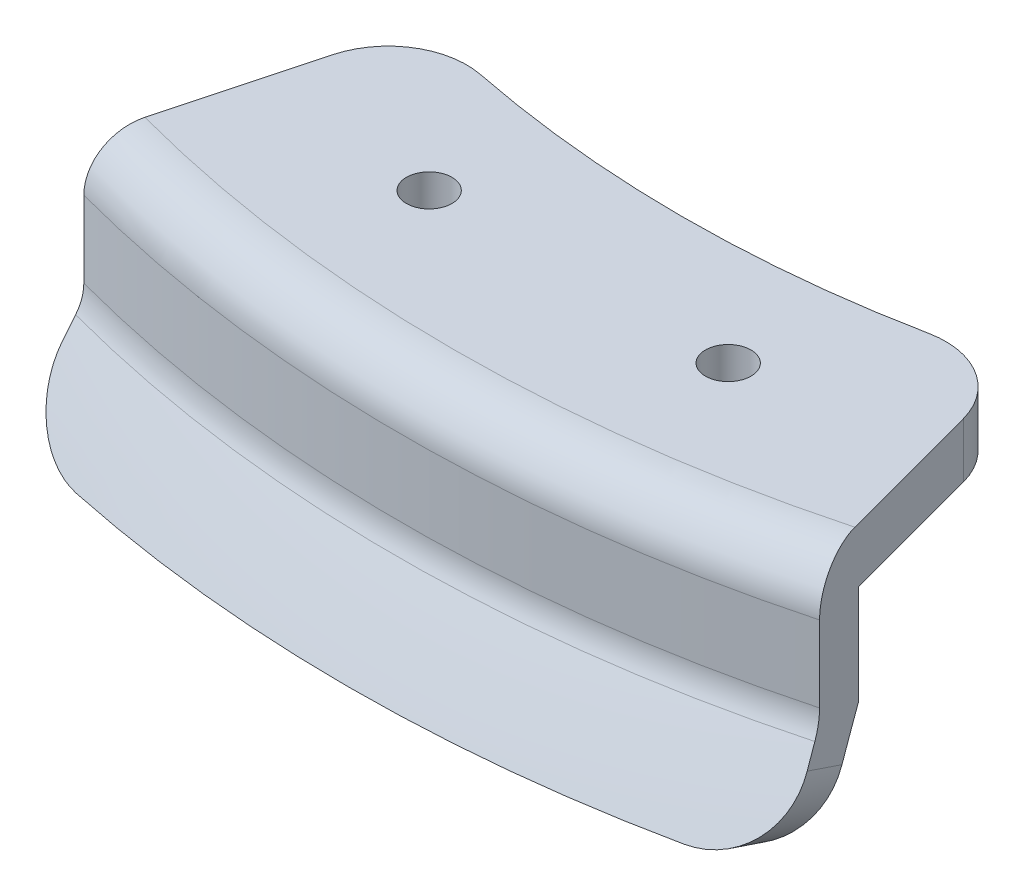
from build123d import *

# Parameters (mm, degrees)
REVOLVE1_ANGLE     = 30
FILLET1_R          = 6.35
SKETCH3_R          = 2.9
CUT_EXTRUDE1_DEPTH = 198.178612884
FILLET2_R          = 10


with BuildPart() as part:
    # Sketch2 → Revolve1 (revolve, symmetric)
    with BuildSketch(Plane(origin=(0, 0, 0), x_dir=(0, 0, -1), z_dir=(1, 0, 0))) as revolve1_sk:
        with BuildLine():
            Line((-174.101233777, 207.368503093), (-174.101233777, 194.668503093))
            ThreePointArc((-174.101233777, 194.668503093), (-178.094473937, 187.727434119), (-181.811130521, 180.634418589))
            Line((-181.811130521, 180.634418589), (-188.07430923, 183.760533184))
            ThreePointArc((-188.07430923, 183.760533184), (-184.699282146, 190.238239534), (-181.101233777, 196.594774384))
            Line((-181.101233777, 196.594774384), (-181.101233777, 214.368503093))
            Line((-181.101233777, 214.368503093), (-145.526233777, 214.368503093))
            Line((-145.526233777, 214.368503093), (-145.526233777, 207.368503093))
            Line((-145.526233777, 207.368503093), (-174.101233777, 207.368503093))
        make_face()
    revolve(axis=Axis((0, 89.887777778, 0), (0, 1, 0)), revolution_arc=REVOLVE1_ANGLE / 2)
    revolve(revolve1_sk.sketch, axis=Axis((0, 89.887777778, 0), (0, -1, 0)), revolution_arc=REVOLVE1_ANGLE / 2)

    # Fillet1
    fillet1_edges = [part.edges().sort_by_distance(p)[0] for p in [
        (0, 196.594774384, 181.101233777),
        (0, 214.368503093, 181.101233777),
    ]]
    fillet(fillet1_edges, radius=FILLET1_R)

    # Sketch3 → Cut-Extrude1 (cut, through all)
    with BuildSketch(Plane.XZ.offset(-214.368503093)):
        with Locations((19.05, 158.75)):
            Circle(SKETCH3_R)
        with Locations((-19.05, 158.75)):
            Circle(SKETCH3_R)
    extrude(amount=CUT_EXTRUDE1_DEPTH, mode=Mode.SUBTRACT)

    # Fillet2
    fillet2_edges = [part.edges().sort_by_distance(p)[0] for p in [
        (-47.866698157, 182.197475887, 178.640949512),
        (47.866698157, 182.197475887, 178.640949512),
        (-37.664960863, 210.868503093, 140.567547607),
        (37.664960863, 210.868503093, 140.567547607),
    ]]
    fillet(fillet2_edges, radius=FILLET2_R)


solid = part.part
